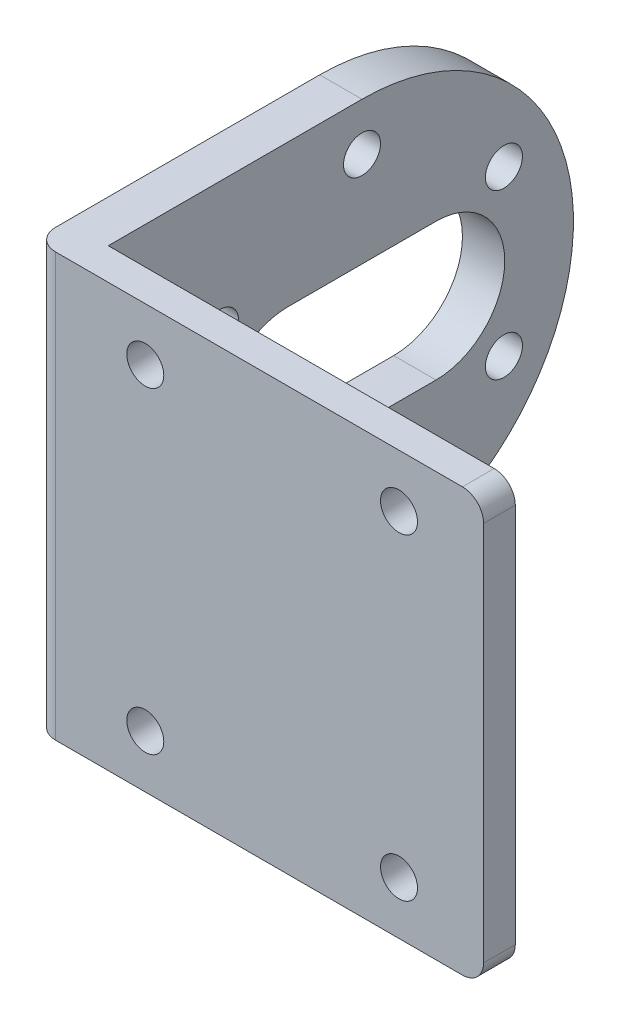
from build123d import *

# Parameters (mm, degrees)
BOSS_EXTRUDE1_DEPTH      = 40
BOSS_EXTRUDE2_DEPTH      = 1
BOSS_EXTRUDE2_DEPTH_BACK = 3
CUT_EXTRUDE1_DEPTH       = 73.740978822
SKETCH5_R                = 1.75
CUT_EXTRUDE2_DEPTH       = 73.740978822
FILLET1_R                = 2
CUT_EXTRUDE3_REACH       = 76.935
SKETCH6_R                = 1.75


with BuildPart() as part:
    # Sketch1 → Boss-Extrude1 (new body)
    with BuildSketch(Plane(origin=(0, 0, 0), x_dir=(1, 0, 0), z_dir=(0, 1, 0))):
        Polygon((0, 0), (0, 27), (3, 27), (3, 3), (42.5, 3), (42.5, 0), align=None)
    extrude(amount=BOSS_EXTRUDE1_DEPTH)

    # Sketch2 → Boss-Extrude2 (add, two sides: drawn at the far end of the back side and taken through both)
    with BuildSketch(Plane(origin=(3, 0, 0), x_dir=(0, 0, -1), z_dir=(1, 0, 0)).offset(-BOSS_EXTRUDE2_DEPTH_BACK)):
        with BuildLine():
            Line((3, 0), (27, 0))
            ThreePointArc((27, 0), (47, 20), (27, 40))
            Line((27, 40), (3, 40))
            Line((3, 40), (3, 0))
        make_face()
    extrude(amount=BOSS_EXTRUDE2_DEPTH + BOSS_EXTRUDE2_DEPTH_BACK)

    # Sketch3 → Cut-Extrude1 (cut, through all)
    with BuildSketch(Plane(origin=(4, 0, 0), x_dir=(0, 0, -1), z_dir=(1, 0, 0))):
        with BuildLine():
            Line((20, 26.5), (34, 26.5))
            ThreePointArc((34, 26.5), (40.5, 20), (34, 13.5))
            Line((34, 13.5), (20, 13.5))
            ThreePointArc((20, 13.5), (13.5, 20), (20, 26.5))
        make_face()
    extrude(amount=-CUT_EXTRUDE1_DEPTH, mode=Mode.SUBTRACT)

    # Sketch5 → Cut-Extrude2 (cut, through all)
    with BuildSketch(Plane(origin=(4, 0, 0), x_dir=(0, 0, -1), z_dir=(1, 0, 0))):
        with Locations((27, 4.5)):
            Circle(SKETCH5_R)
        with Locations((13.576606241, 12.25)):
            Circle(SKETCH5_R)
        with Locations((13.576606241, 27.75)):
            Circle(SKETCH5_R)
        with Locations((27, 35.5)):
            Circle(SKETCH5_R)
        with Locations((40.423393759, 27.75)):
            Circle(SKETCH5_R)
        with Locations((40.423393759, 12.25)):
            Circle(SKETCH5_R)
    extrude(amount=-CUT_EXTRUDE2_DEPTH, mode=Mode.SUBTRACT)

    # Fillet1
    fillet1_edges = [part.edges().sort_by_distance(p)[0] for p in [
        (42.5, 40, -1.5),
        (42.5, 0, -1.5),
        (0, 20, 0),
    ]]
    fillet(fillet1_edges, radius=FILLET1_R)

    # Sketch6 → Cut-Extrude3 (cut, up to next)
    with BuildSketch(Plane.XY, mode=Mode.PRIVATE) as cut_extrude3_sk1:
        with Locations((34.5, 5)):
            Circle(SKETCH6_R)
    cut_extrude3_tool1 = extrude(cut_extrude3_sk1.sketch, amount=-CUT_EXTRUDE3_REACH, mode=Mode.PRIVATE) & part.part
    # Sketch6 → Cut-Extrude3 (cut, up to next)
    with BuildSketch(Plane.XY, mode=Mode.PRIVATE) as cut_extrude3_sk2:
        with Locations((34.5, 35)):
            Circle(SKETCH6_R)
    cut_extrude3_tool2 = extrude(cut_extrude3_sk2.sketch, amount=-CUT_EXTRUDE3_REACH, mode=Mode.PRIVATE) & part.part
    # Sketch6 → Cut-Extrude3 (cut, up to next)
    with BuildSketch(Plane.XY, mode=Mode.PRIVATE) as cut_extrude3_sk3:
        with Locations((10.5, 35)):
            Circle(SKETCH6_R)
    cut_extrude3_tool3 = extrude(cut_extrude3_sk3.sketch, amount=-CUT_EXTRUDE3_REACH, mode=Mode.PRIVATE) & part.part
    # Sketch6 → Cut-Extrude3 (cut, up to next)
    with BuildSketch(Plane.XY, mode=Mode.PRIVATE) as cut_extrude3_sk4:
        with Locations((10.5, 5)):
            Circle(SKETCH6_R)
    cut_extrude3_tool4 = extrude(cut_extrude3_sk4.sketch, amount=-CUT_EXTRUDE3_REACH, mode=Mode.PRIVATE) & part.part
    add(cut_extrude3_tool1.solids().sort_by_distance((34.5, 5, 0))[0], mode=Mode.SUBTRACT)
    add(cut_extrude3_tool2.solids().sort_by_distance((34.5, 35, 0))[0], mode=Mode.SUBTRACT)
    add(cut_extrude3_tool3.solids().sort_by_distance((10.5, 35, 0))[0], mode=Mode.SUBTRACT)
    add(cut_extrude3_tool4.solids().sort_by_distance((10.5, 5, 0))[0], mode=Mode.SUBTRACT)


solid = part.part
